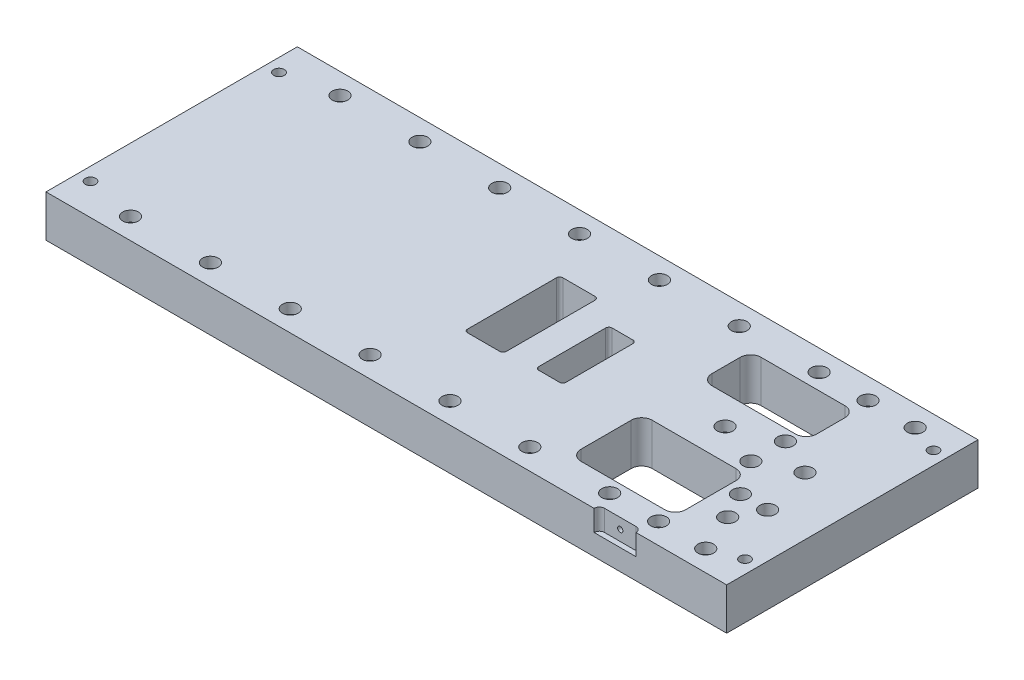
from build123d import *

# Parameters (mm, degrees)
SKETCH1_W                    = 650
SKETCH1_H                    = 240
BOSS_EXTRUDE1_DEPTH          = 40
CUT_EXTRUDE2_REACH           = 350.748
SKETCH3_R                    = 7.5
SKETCH4_R                    = 9
CUT_EXTRUDE3_DEPTH           = 5
SKETCH11_R                   = 7.5
CUT_EXTRUDE9_DEPTH           = 643.21019682
SKETCH12_R                   = 10
CUT_EXTRUDE10_DEPTH          = 5
SKETCH13_R                   = 10
CUT_EXTRUDE11_DEPTH          = 30
M10_TAPPED_HOLE1_D           = 8.5
M10_TAPPED_HOLE1_DEPTH       = 27.5
M10_TAPPED_HOLE1_CSINK_D     = 10.05
M10_TAPPED_HOLE1_CSINK_ANGLE = 90
M10_TAPPED_HOLE1_TIP         = 2.553657631
F_10_0MM_DOWEL_HOLE2_D       = 10
CUT_EXTRUDE12_REACH          = 350.748
SKETCH28_R                   = 7.5
SKETCH29_R                   = 9
CUT_EXTRUDE13_DEPTH          = 30
CUT_EXTRUDE14_DEPTH          = 20
M6_TAPPED_HOLE1_D            = 5
M6_TAPPED_HOLE1_DEPTH        = 10
M6_TAPPED_HOLE1_TIP          = 1.502151548
CUT_EXTRUDE15_REACH          = 350.748
CUT_EXTRUDE16_REACH          = 350.748


with BuildPart() as part:
    # Sketch1 → Boss-Extrude1 (new body)
    with BuildSketch(Plane(origin=(0, 0, 0), x_dir=(1, 0, 0), z_dir=(0, 1, 0))):
        Rectangle(SKETCH1_W, SKETCH1_H)
    extrude(amount=-BOSS_EXTRUDE1_DEPTH)

    # Sketch3 → Cut-Extrude2 (cut, up to next)
    with BuildSketch(Plane(origin=(0, 0, 0), x_dir=(1, 0, 0), z_dir=(0, 1, 0)), mode=Mode.PRIVATE) as cut_extrude2_sk1:
        with Locations((234.38, 26.73)):
            Circle(SKETCH3_R)
    cut_extrude2_tool1 = extrude(cut_extrude2_sk1.sketch, amount=-CUT_EXTRUDE2_REACH, mode=Mode.PRIVATE) & part.part
    # Sketch3 → Cut-Extrude2 (cut, up to next)
    with BuildSketch(Plane(origin=(0, 0, 0), x_dir=(1, 0, 0), z_dir=(0, 1, 0)), mode=Mode.PRIVATE) as cut_extrude2_sk2:
        with Locations((234.38, -6.27)):
            Circle(SKETCH3_R)
    cut_extrude2_tool2 = extrude(cut_extrude2_sk2.sketch, amount=-CUT_EXTRUDE2_REACH, mode=Mode.PRIVATE) & part.part
    # Sketch3 → Cut-Extrude2 (cut, up to next)
    with BuildSketch(Plane(origin=(0, 0, 0), x_dir=(1, 0, 0), z_dir=(0, 1, 0)), mode=Mode.PRIVATE) as cut_extrude2_sk3:
        with Locations((269.5, -63.53)):
            Circle(SKETCH3_R)
    cut_extrude2_tool3 = extrude(cut_extrude2_sk3.sketch, amount=-CUT_EXTRUDE2_REACH, mode=Mode.PRIVATE) & part.part
    # Sketch3 → Cut-Extrude2 (cut, up to next)
    with BuildSketch(Plane(origin=(0, 0, 0), x_dir=(1, 0, 0), z_dir=(0, 1, 0)), mode=Mode.PRIVATE) as cut_extrude2_sk4:
        with Locations((282.5, -38.4)):
            Circle(SKETCH3_R)
    cut_extrude2_tool4 = extrude(cut_extrude2_sk4.sketch, amount=-CUT_EXTRUDE2_REACH, mode=Mode.PRIVATE) & part.part
    # Sketch3 → Cut-Extrude2 (cut, up to next)
    with BuildSketch(Plane(origin=(0, 0, 0), x_dir=(1, 0, 0), z_dir=(0, 1, 0)), mode=Mode.PRIVATE) as cut_extrude2_sk5:
        with Locations((256.5, -38.4)):
            Circle(SKETCH3_R)
    cut_extrude2_tool5 = extrude(cut_extrude2_sk5.sketch, amount=-CUT_EXTRUDE2_REACH, mode=Mode.PRIVATE) & part.part
    # Sketch3 → Cut-Extrude2 (cut, up to next)
    with BuildSketch(Plane(origin=(0, 0, 0), x_dir=(1, 0, 0), z_dir=(0, 1, 0)), mode=Mode.PRIVATE) as cut_extrude2_sk6:
        with BuildLine():
            Line((153.25, 84.63), (233.25, 84.63))
            ThreePointArc((233.25, 84.63), (240.321067812, 81.701067812), (243.25, 74.63))
            Line((243.25, 74.63), (243.25, 47.63))
            ThreePointArc((243.25, 47.63), (240.321067812, 40.558932188), (233.25, 37.63))
            Line((233.25, 37.63), (153.25, 37.63))
            ThreePointArc((153.25, 37.63), (146.178932188, 40.558932188), (143.25, 47.63))
            Line((143.25, 47.63), (143.25, 74.63))
            ThreePointArc((143.25, 74.63), (146.178932188, 81.701067812), (153.25, 84.63))
        make_face()
    cut_extrude2_tool6 = extrude(cut_extrude2_sk6.sketch, amount=-CUT_EXTRUDE2_REACH, mode=Mode.PRIVATE) & part.part
    # Sketch3 → Cut-Extrude2 (cut, up to next)
    with BuildSketch(Plane(origin=(0, 0, 0), x_dir=(1, 0, 0), z_dir=(0, 1, 0)), mode=Mode.PRIVATE) as cut_extrude2_sk7:
        with BuildLine():
            Line((153.25, -19.4), (233.25, -19.4))
            ThreePointArc((233.25, -19.4), (240.321067812, -22.328932188), (243.25, -29.4))
            Line((243.25, -29.4), (243.25, -77.4))
            ThreePointArc((243.25, -77.4), (240.321067812, -84.471067812), (233.25, -87.4))
            Line((233.25, -87.4), (153.25, -87.4))
            ThreePointArc((153.25, -87.4), (146.178932188, -84.471067812), (143.25, -77.4))
            Line((143.25, -77.4), (143.25, -29.4))
            ThreePointArc((143.25, -29.4), (146.178932188, -22.328932188), (153.25, -19.4))
        make_face()
    cut_extrude2_tool7 = extrude(cut_extrude2_sk7.sketch, amount=-CUT_EXTRUDE2_REACH, mode=Mode.PRIVATE) & part.part
    add(cut_extrude2_tool1.solids().sort_by_distance((234.38, 0, -26.73))[0], mode=Mode.SUBTRACT)
    add(cut_extrude2_tool2.solids().sort_by_distance((234.38, 0, 6.27))[0], mode=Mode.SUBTRACT)
    add(cut_extrude2_tool3.solids().sort_by_distance((269.5, 0, 63.53))[0], mode=Mode.SUBTRACT)
    add(cut_extrude2_tool4.solids().sort_by_distance((282.5, 0, 38.4))[0], mode=Mode.SUBTRACT)
    add(cut_extrude2_tool5.solids().sort_by_distance((256.5, 0, 38.4))[0], mode=Mode.SUBTRACT)
    add(cut_extrude2_tool6.solids().sort_by_distance((193.25, 0, -61.13))[0], mode=Mode.SUBTRACT)
    add(cut_extrude2_tool7.solids().sort_by_distance((193.25, 0, 53.4))[0], mode=Mode.SUBTRACT)

    # Sketch4 → Cut-Extrude3 (cut)
    with BuildSketch(Plane.XZ.offset(40)):
        with Locations((234.38, -26.73)):
            Circle(SKETCH4_R)
        with Locations((234.38, 6.27)):
            Circle(SKETCH4_R)
        with Locations((256.5, 38.4)):
            Circle(SKETCH4_R)
        with Locations((282.5, 38.4)):
            Circle(SKETCH4_R)
        with Locations((269.5, 63.53)):
            Circle(SKETCH4_R)
    extrude(amount=-CUT_EXTRUDE3_DEPTH, mode=Mode.SUBTRACT)

    # Sketch11 → Cut-Extrude9 (cut, through all)
    with BuildSketch(Plane(origin=(304.63, 0, 0), x_dir=(1, 0, 0), z_dir=(0, 1, 0))):
        with Locations((-35.13, 10.23)):
            Circle(SKETCH11_R)
        with Locations((-111.38, 10.23)):
            Circle(SKETCH11_R)
    extrude(amount=-CUT_EXTRUDE9_DEPTH, mode=Mode.SUBTRACT)

    # Sketch12 → Cut-Extrude10 (cut)
    with BuildSketch(Plane(origin=(304.63, -40, 0), x_dir=(1, 0, 0), z_dir=(0, -1, 0))):
        with Locations((-35.13, -10.23)):
            Circle(SKETCH12_R)
    extrude(amount=-CUT_EXTRUDE10_DEPTH, mode=Mode.SUBTRACT)

    # Sketch13 → Cut-Extrude11 (cut)
    with BuildSketch(Plane(origin=(304.63, -40, 0), x_dir=(1, 0, 0), z_dir=(0, -1, 0))):
        with Locations((-111.38, -10.23)):
            Circle(SKETCH13_R)
    extrude(amount=-CUT_EXTRUDE11_DEPTH, mode=Mode.SUBTRACT)

    # M10 Tapped Hole1
    with Locations(Plane(origin=(0, -40, 0), x_dir=(-1, 0, 0), z_dir=(0, -1, 0))):
        with Locations((-312.5, 107.5), (312.5, 107.5), (312.5, -107.5), (-312.5, -107.5)):
            CounterSinkHole(M10_TAPPED_HOLE1_D / 2, M10_TAPPED_HOLE1_CSINK_D / 2, depth=M10_TAPPED_HOLE1_DEPTH, counter_sink_angle=M10_TAPPED_HOLE1_CSINK_ANGLE)
            with Locations((0, 0, -(M10_TAPPED_HOLE1_DEPTH + M10_TAPPED_HOLE1_TIP / 2))):  # 118° drill point
                Cone(0, M10_TAPPED_HOLE1_D / 2, M10_TAPPED_HOLE1_TIP, mode=Mode.SUBTRACT)

    # Ø10.0mm Dowel Hole2 (through all)
    with Locations(Plane(origin=(0, -40, 0), x_dir=(-1, 0, 0), z_dir=(0, -1, 0))):
        with Locations((-312.5, 90), (312.5, 90), (312.5, -90), (-312.5, -90)):
            Hole(F_10_0MM_DOWEL_HOLE2_D / 2)

    # Sketch28 → Cut-Extrude12 (cut, up to next)
    with BuildSketch(Plane(origin=(0, 0, 0), x_dir=(1, 0, 0), z_dir=(0, 1, 0)), mode=Mode.PRIVATE) as cut_extrude12_sk1:
        with Locations((240, -100)):
            Circle(SKETCH28_R)
    cut_extrude12_tool1 = extrude(cut_extrude12_sk1.sketch, amount=-CUT_EXTRUDE12_REACH, mode=Mode.PRIVATE) & part.part
    # Sketch28 → Cut-Extrude12 (cut, up to next)
    with BuildSketch(Plane(origin=(0, 0, 0), x_dir=(1, 0, 0), z_dir=(0, 1, 0)), mode=Mode.PRIVATE) as cut_extrude12_sk2:
        with Locations((285, -100)):
            Circle(SKETCH28_R)
    cut_extrude12_tool2 = extrude(cut_extrude12_sk2.sketch, amount=-CUT_EXTRUDE12_REACH, mode=Mode.PRIVATE) & part.part
    # Sketch28 → Cut-Extrude12 (cut, up to next)
    with BuildSketch(Plane(origin=(0, 0, 0), x_dir=(1, 0, 0), z_dir=(0, 1, 0)), mode=Mode.PRIVATE) as cut_extrude12_sk3:
        with Locations((117, -100)):
            Circle(SKETCH28_R)
    cut_extrude12_tool3 = extrude(cut_extrude12_sk3.sketch, amount=-CUT_EXTRUDE12_REACH, mode=Mode.PRIVATE) & part.part
    # Sketch28 → Cut-Extrude12 (cut, up to next)
    with BuildSketch(Plane(origin=(0, 0, 0), x_dir=(1, 0, 0), z_dir=(0, 1, 0)), mode=Mode.PRIVATE) as cut_extrude12_sk4:
        with Locations((40.75, -100)):
            Circle(SKETCH28_R)
    cut_extrude12_tool4 = extrude(cut_extrude12_sk4.sketch, amount=-CUT_EXTRUDE12_REACH, mode=Mode.PRIVATE) & part.part
    # Sketch28 → Cut-Extrude12 (cut, up to next)
    with BuildSketch(Plane(origin=(0, 0, 0), x_dir=(1, 0, 0), z_dir=(0, 1, 0)), mode=Mode.PRIVATE) as cut_extrude12_sk5:
        with Locations((193.25, -100)):
            Circle(SKETCH28_R)
    cut_extrude12_tool5 = extrude(cut_extrude12_sk5.sketch, amount=-CUT_EXTRUDE12_REACH, mode=Mode.PRIVATE) & part.part
    # Sketch28 → Cut-Extrude12 (cut, up to next)
    with BuildSketch(Plane(origin=(0, 0, 0), x_dir=(1, 0, 0), z_dir=(0, 1, 0)), mode=Mode.PRIVATE) as cut_extrude12_sk6:
        with Locations((-35.5, -100)):
            Circle(SKETCH28_R)
    cut_extrude12_tool6 = extrude(cut_extrude12_sk6.sketch, amount=-CUT_EXTRUDE12_REACH, mode=Mode.PRIVATE) & part.part
    # Sketch28 → Cut-Extrude12 (cut, up to next)
    with BuildSketch(Plane(origin=(0, 0, 0), x_dir=(1, 0, 0), z_dir=(0, 1, 0)), mode=Mode.PRIVATE) as cut_extrude12_sk7:
        with Locations((-111.75, -100)):
            Circle(SKETCH28_R)
    cut_extrude12_tool7 = extrude(cut_extrude12_sk7.sketch, amount=-CUT_EXTRUDE12_REACH, mode=Mode.PRIVATE) & part.part
    # Sketch28 → Cut-Extrude12 (cut, up to next)
    with BuildSketch(Plane(origin=(0, 0, 0), x_dir=(1, 0, 0), z_dir=(0, 1, 0)), mode=Mode.PRIVATE) as cut_extrude12_sk8:
        with Locations((-188, -100)):
            Circle(SKETCH28_R)
    cut_extrude12_tool8 = extrude(cut_extrude12_sk8.sketch, amount=-CUT_EXTRUDE12_REACH, mode=Mode.PRIVATE) & part.part
    # Sketch28 → Cut-Extrude12 (cut, up to next)
    with BuildSketch(Plane(origin=(0, 0, 0), x_dir=(1, 0, 0), z_dir=(0, 1, 0)), mode=Mode.PRIVATE) as cut_extrude12_sk9:
        with Locations((-264.25, -100)):
            Circle(SKETCH28_R)
    cut_extrude12_tool9 = extrude(cut_extrude12_sk9.sketch, amount=-CUT_EXTRUDE12_REACH, mode=Mode.PRIVATE) & part.part
    cut_extrude12_1 = cut_extrude12_tool1.solids().sort_by_distance((240, 0, 100))[0]
    add(cut_extrude12_1, mode=Mode.SUBTRACT)
    cut_extrude12_2 = cut_extrude12_tool2.solids().sort_by_distance((285, 0, 100))[0]
    add(cut_extrude12_2, mode=Mode.SUBTRACT)
    cut_extrude12_3 = cut_extrude12_tool3.solids().sort_by_distance((117, 0, 100))[0]
    add(cut_extrude12_3, mode=Mode.SUBTRACT)
    cut_extrude12_4 = cut_extrude12_tool4.solids().sort_by_distance((40.75, 0, 100))[0]
    add(cut_extrude12_4, mode=Mode.SUBTRACT)
    cut_extrude12_5 = cut_extrude12_tool5.solids().sort_by_distance((193.25, 0, 100))[0]
    add(cut_extrude12_5, mode=Mode.SUBTRACT)
    cut_extrude12_6 = cut_extrude12_tool6.solids().sort_by_distance((-35.5, 0, 100))[0]
    add(cut_extrude12_6, mode=Mode.SUBTRACT)
    cut_extrude12_7 = cut_extrude12_tool7.solids().sort_by_distance((-111.75, 0, 100))[0]
    add(cut_extrude12_7, mode=Mode.SUBTRACT)
    cut_extrude12_8 = cut_extrude12_tool8.solids().sort_by_distance((-188, 0, 100))[0]
    add(cut_extrude12_8, mode=Mode.SUBTRACT)
    cut_extrude12_9 = cut_extrude12_tool9.solids().sort_by_distance((-264.25, 0, 100))[0]
    add(cut_extrude12_9, mode=Mode.SUBTRACT)
    cut_extrude12 = cut_extrude12_1 + cut_extrude12_2 + cut_extrude12_3 + cut_extrude12_4 + cut_extrude12_5 + cut_extrude12_6 + cut_extrude12_7 + cut_extrude12_8 + cut_extrude12_9  # Cut-Extrude12 as one shape, for the pattern or mirror that repeats it

    # Mirror1: Cut-Extrude12 across plane
    add(cut_extrude12.mirror(Plane.XY), mode=Mode.SUBTRACT)

    # Sketch29 → Cut-Extrude13 (cut)
    with BuildSketch(Plane.XZ.offset(40)):
        with Locations((193.25, 100)):
            Circle(SKETCH29_R)
        with Locations((240, 100)):
            Circle(SKETCH29_R)
        with Locations((240, -100)):
            Circle(SKETCH29_R)
        with Locations((193.25, -100)):
            Circle(SKETCH29_R)
        with Locations((285, 100)):
            Circle(SKETCH29_R)
        with Locations((285, -100)):
            Circle(SKETCH29_R)
        with Locations((117, 100)):
            Circle(SKETCH29_R)
        with Locations((117, -100)):
            Circle(SKETCH29_R)
        with Locations((40.75, 100)):
            Circle(SKETCH29_R)
        with Locations((40.75, -100)):
            Circle(SKETCH29_R)
        with Locations((-35.5, 100)):
            Circle(SKETCH29_R)
        with Locations((-35.5, -100)):
            Circle(SKETCH29_R)
        with Locations((-111.75, 100)):
            Circle(SKETCH29_R)
        with Locations((-111.75, -100)):
            Circle(SKETCH29_R)
        with Locations((-188, 100)):
            Circle(SKETCH29_R)
        with Locations((-188, -100)):
            Circle(SKETCH29_R)
        with Locations((-264.25, 100)):
            Circle(SKETCH29_R)
        with Locations((-264.25, -100)):
            Circle(SKETCH29_R)
    extrude(amount=-CUT_EXTRUDE13_DEPTH, mode=Mode.SUBTRACT)

    # Sketch30 → Cut-Extrude14 (cut)
    with BuildSketch(Plane(origin=(304.63, 0, 0), x_dir=(1, 0, 0), z_dir=(0, 1, 0))):
        with BuildLine():
            Line((-106.25, -120), (-66.25, -120))
            ThreePointArc((-66.25, -120), (-67.714466094, -116.464466094), (-71.25, -115))
            Line((-71.25, -115), (-101.25, -115))
            ThreePointArc((-101.25, -115), (-104.785533906, -116.464466094), (-106.25, -120))
        make_face()
    extrude(amount=-CUT_EXTRUDE14_DEPTH, mode=Mode.SUBTRACT)

    # M6 Tapped Hole1
    with Locations(Plane.XY.offset(115)):
        with Locations((218.38, -10)):
            Hole(M6_TAPPED_HOLE1_D / 2, depth=M6_TAPPED_HOLE1_DEPTH)
            with Locations((0, 0, -(M6_TAPPED_HOLE1_DEPTH + M6_TAPPED_HOLE1_TIP / 2))):  # 118° drill point
                Cone(0, M6_TAPPED_HOLE1_D / 2, M6_TAPPED_HOLE1_TIP, mode=Mode.SUBTRACT)

    # Sketch38 → Cut-Extrude15 (cut, up to next)
    with BuildSketch(Plane(origin=(0, 0, 0), x_dir=(1, 0, 0), z_dir=(0, 1, 0)), mode=Mode.PRIVATE) as cut_extrude15_sk1:
        with BuildLine():
            Line((57.75, -32.27), (77.75, -32.27))
            ThreePointArc((77.75, -32.27), (79.871320344, -31.391320344), (80.75, -29.27))
            Line((80.75, -29.27), (80.75, 34.73))
            ThreePointArc((80.75, 34.73), (79.871320344, 36.851320344), (77.75, 37.73))
            Line((77.75, 37.73), (57.75, 37.73))
            ThreePointArc((57.75, 37.73), (55.628679656, 36.851320344), (54.75, 34.73))
            Line((54.75, 34.73), (54.75, -29.27))
            ThreePointArc((54.75, -29.27), (55.628679656, -31.391320344), (57.75, -32.27))
        make_face()
    cut_extrude15_tool1 = extrude(cut_extrude15_sk1.sketch, amount=-CUT_EXTRUDE15_REACH, mode=Mode.PRIVATE) & part.part
    add(cut_extrude15_tool1.solids().sort_by_distance((67.75, 0, -2.73))[0], mode=Mode.SUBTRACT)

    # Sketch39 → Cut-Extrude16 (cut, up to next)
    with BuildSketch(Plane(origin=(0, 0, 0), x_dir=(1, 0, 0), z_dir=(0, 1, 0)), mode=Mode.PRIVATE) as cut_extrude16_sk1:
        with BuildLine():
            Line((-7.25, -35.27), (23.75, -35.27))
            ThreePointArc((23.75, -35.27), (25.871320344, -34.391320344), (26.75, -32.27))
            Line((26.75, -32.27), (26.75, 52.73))
            ThreePointArc((26.75, 52.73), (25.871320344, 54.851320344), (23.75, 55.73))
            Line((23.75, 55.73), (-7.25, 55.73))
            ThreePointArc((-7.25, 55.73), (-9.371320344, 54.851320344), (-10.25, 52.73))
            Line((-10.25, 52.73), (-10.25, -32.27))
            ThreePointArc((-10.25, -32.27), (-9.371320344, -34.391320344), (-7.25, -35.27))
        make_face()
    cut_extrude16_tool1 = extrude(cut_extrude16_sk1.sketch, amount=-CUT_EXTRUDE16_REACH, mode=Mode.PRIVATE) & part.part
    add(cut_extrude16_tool1.solids().sort_by_distance((8.25, 0, -10.23))[0], mode=Mode.SUBTRACT)


solid = part.part
